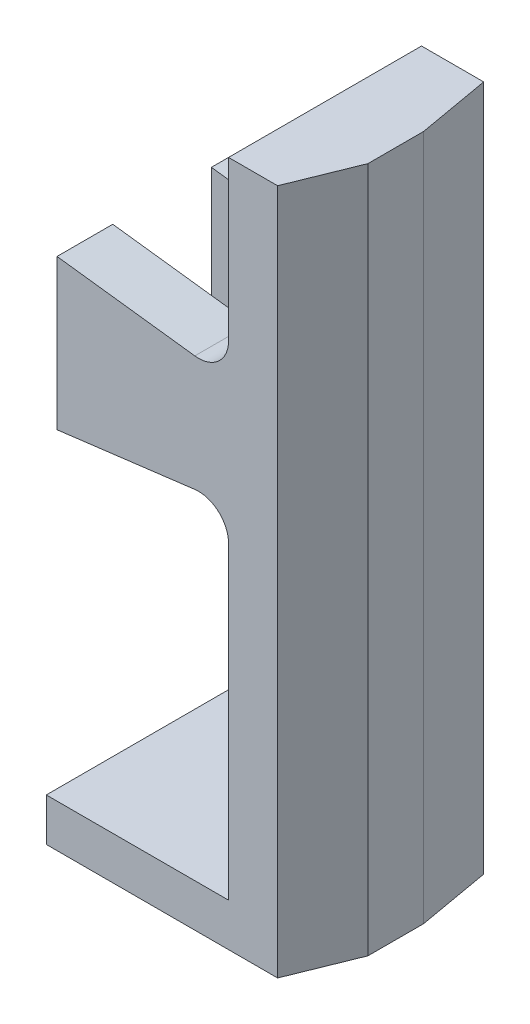
from build123d import *

# Parameters (mm, degrees)
BOSS_EXTRUDE1_DEPTH = 28.575
CHAMFER1_SIZE       = 19.05
CHAMFER1_SIZE2      = 7.696699602
CHAMFER2_SIZE       = 3.81
CHAMFER2_SIZE2      = 21.607583733
BOSS_EXTRUDE2_DEPTH = 11.43
BOSS_EXTRUDE3_DEPTH = 16.51
FILLET1_R           = 8.89
CHAMFER3_SIZE       = 2.54


with BuildPart() as part:
    # Sketch1 → Boss-Extrude1 (new, symmetric)
    with BuildSketch(Plane(origin=(0, 0, 0), x_dir=(0, 1, 0), z_dir=(0, 0, 1))):
        Polygon((-190.5, 76.2), (-203.2, 76.2), (-203.2, 0), (0, 0), (0, 22.225), (-190.5, 22.225), align=None)
    extrude(amount=BOSS_EXTRUDE1_DEPTH, both=True)

    # Chamfer1
    chamfer1_edges = [part.edges().sort_by_distance(p)[0] for p in [
        (0, -101.6, 28.575),
    ]]
    chamfer1_side = [part.faces().sort_by_distance(p)[0] for p in [
        (0, -101.6, 0),
    ]]
    chamfer(chamfer1_edges, length=CHAMFER1_SIZE, length2=CHAMFER1_SIZE2, reference=chamfer1_side[0])

    # Chamfer2
    chamfer2_edges = [part.edges().sort_by_distance(p)[0] for p in [
        (0, -101.6, -28.575),
    ]]
    chamfer2_side = [part.faces().sort_by_distance(p)[0] for p in [
        (-16.133430233, -114.152325581, -28.575),
    ]]
    chamfer(chamfer2_edges, length=CHAMFER2_SIZE, length2=CHAMFER2_SIZE2, reference=chamfer2_side[0])

    # Sketch3 → Boss-Extrude2 (add)
    with BuildSketch(Plane(origin=(0, 0, -28.575), x_dir=(1, 0, 0), z_dir=(0, 0, -1))):
        Polygon((-22.225, 88.9), (-73.025, 95.25), (-73.025, 50.8), (-22.225, 57.15), align=None)
    extrude(amount=-BOSS_EXTRUDE2_DEPTH)

    # Sketch4 → Boss-Extrude3 (add)
    with BuildSketch(Plane.XY.offset(28.575)):
        Polygon((-22.225, -57.15), (-73.025, -50.8), (-73.025, -95.25), (-22.225, -88.9), align=None)
    extrude(amount=-BOSS_EXTRUDE3_DEPTH)

    # Fillet1
    fillet1_edges = [part.edges().sort_by_distance(p)[0] for p in [
        (-22.225, -88.9, -22.86),
        (-22.225, -57.15, -22.86),
        (-22.225, -88.9, 20.32),
        (-22.225, -57.15, 20.32),
    ]]
    fillet(fillet1_edges, radius=FILLET1_R)

    # Chamfer3
    chamfer3_edges = [part.edges().sort_by_distance(p)[0] for p in [
        (-22.225, -73.025, -17.145),
        (-22.225, -73.025, 12.065),
    ]]
    chamfer(chamfer3_edges, length=CHAMFER3_SIZE)


solid = part.part
